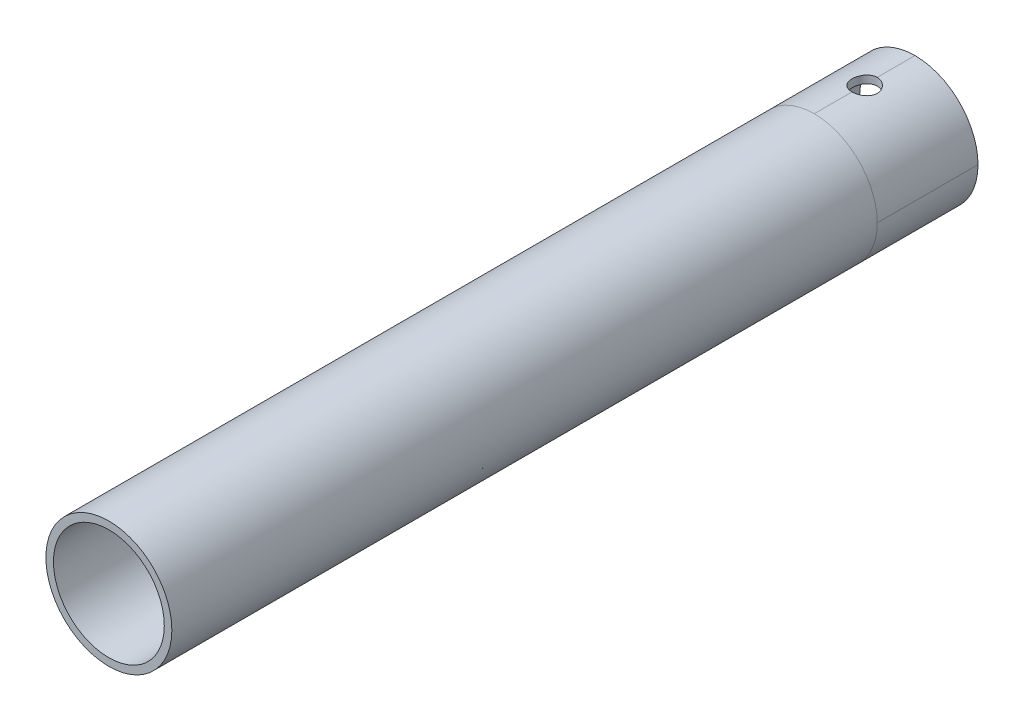
from build123d import *
from build123d.topology import SkipClean

# Parameters (mm, degrees)
ESBO_O1_R                = 12.5
ESBO_O1_R_2              = 11
RESSALTO_EXTRUS_O1_DEPTH = 140
RESSALTO_EXTRUS_O2_START = 20
ESBO_O2_R                = 12.5
ESBO_O2_R_2              = 11
RESSALTO_EXTRUS_O2_DEPTH = 20
ESBO_O3_R                = 2.5
CORTE_EXTRUS_O1_DEPTH    = 40
FILETE1_START            = -20
FILETE1_DEPTH            = 20


with BuildPart() as part:
    # Esboço1 → Ressalto-extrusão1 (new body)
    with BuildSketch(Plane.XY):
        Circle(ESBO_O1_R)
        Circle(ESBO_O1_R_2, mode=Mode.SUBTRACT)
    extrude(amount=RESSALTO_EXTRUS_O1_DEPTH)

    # Esboço2 → Ressalto-extrusão2 (add)
    # profile 1 of 5: a face of its own
    with SkipClean():  # the faces are left unmerged after this step: merging them gives an invalid solid
        with BuildSketch(Plane(origin=(0, 0, 0), x_dir=(-1, 0, 0), z_dir=(0, 0, -1)).offset(RESSALTO_EXTRUS_O2_START)):
            with BuildLine():
                Line((12.5, 12.5), (0, 12.5))
                ThreePointArc((0, 12.5), (8.838834765, 8.838834765), (12.5, 0))
                Line((12.5, 0), (12.5, 12.5))
            make_face()
        # profile 2 of 5: a face of its own
        with BuildSketch(Plane(origin=(0, 0, 0), x_dir=(-1, 0, 0), z_dir=(0, 0, -1)).offset(RESSALTO_EXTRUS_O2_START)):
            with BuildLine():
                Line((12.5, -12.5), (12.5, 0))
                ThreePointArc((12.5, 0), (8.838834747, -8.838834783), (-5.1e-08, -12.5))
                Line((-5.1e-08, -12.5), (12.5, -12.5))
            make_face()
        # profile 3 of 5: a face of its own
        with BuildSketch(Plane(origin=(0, 0, 0), x_dir=(-1, 0, 0), z_dir=(0, 0, -1)).offset(RESSALTO_EXTRUS_O2_START)):
            with BuildLine():
                ThreePointArc((-5.1e-08, -12.5), (-8.838834783, -8.838834747), (-12.5, 0))
                Line((-12.5, 0), (-12.5, -12.5))
                Line((-12.5, -12.5), (-5.1e-08, -12.5))
            make_face()
        # profile 4 of 5: a face of its own
        with BuildSketch(Plane(origin=(0, 0, 0), x_dir=(-1, 0, 0), z_dir=(0, 0, -1)).offset(RESSALTO_EXTRUS_O2_START)):
            with BuildLine():
                ThreePointArc((-12.5, 0), (-8.838834765, 8.838834765), (0, 12.5))
                Line((0, 12.5), (-12.5, 12.5))
                Line((-12.5, 12.5), (-12.5, 0))
            make_face()
        # profile 5 of 5: a face of its own
        with BuildSketch(Plane(origin=(0, 0, 0), x_dir=(-1, 0, 0), z_dir=(0, 0, -1)).offset(RESSALTO_EXTRUS_O2_START)):
            with Locations(Location((0, 0, 0), (0, 0, 180))):
                Circle(ESBO_O2_R)
            Circle(ESBO_O2_R_2, mode=Mode.SUBTRACT)
        extrude(amount=-RESSALTO_EXTRUS_O2_DEPTH)

    # Esboço3 → Corte-extrusão1 (cut)
    with SkipClean():  # the faces are left unmerged after this step: merging them gives an invalid solid
        with BuildSketch(Plane(origin=(0, -12.5, 0), x_dir=(-1, 0, 0), z_dir=(0, -1, 0))):
            with Locations(Location((0, 10, 0), (0, 0, 90))):
                Circle(ESBO_O3_R)
        extrude(amount=-CORTE_EXTRUS_O1_DEPTH, mode=Mode.SUBTRACT)

    # Filete1: read off the stored shape, not the designer's step
    # Filete1 outline → Filete1 (cut)
    with SkipClean():  # the faces are left unmerged after this step: merging them gives an invalid solid
        with BuildSketch(Plane.XY.offset(FILETE1_START)):
            with BuildLine():
                Line((12.5, 12.5), (0, 12.5))
                ThreePointArc((0, 12.5), (8.838834765, 8.838834765), (12.5, 0))
                Line((12.5, 0), (12.5, 12.5))
            make_face()
            with BuildLine():
                ThreePointArc((-12.5, 0), (-8.838834765, 8.838834765), (0, 12.5))
                Line((0, 12.5), (-12.5, 12.5))
                Line((-12.5, 12.5), (-12.5, 0))
            make_face()
            with BuildLine():
                ThreePointArc((0, -12.5), (-8.838834765, -8.838834765), (-12.5, 0))
                Line((-12.5, 0), (-12.5, -12.5))
                Line((-12.5, -12.5), (0, -12.5))
            make_face()
            with BuildLine():
                Line((12.5, -12.5), (12.5, 0))
                ThreePointArc((12.5, 0), (8.838834765, -8.838834765), (0, -12.5))
                Line((0, -12.5), (12.5, -12.5))
            make_face()
        extrude(amount=FILETE1_DEPTH, mode=Mode.SUBTRACT)


solid = part.part
